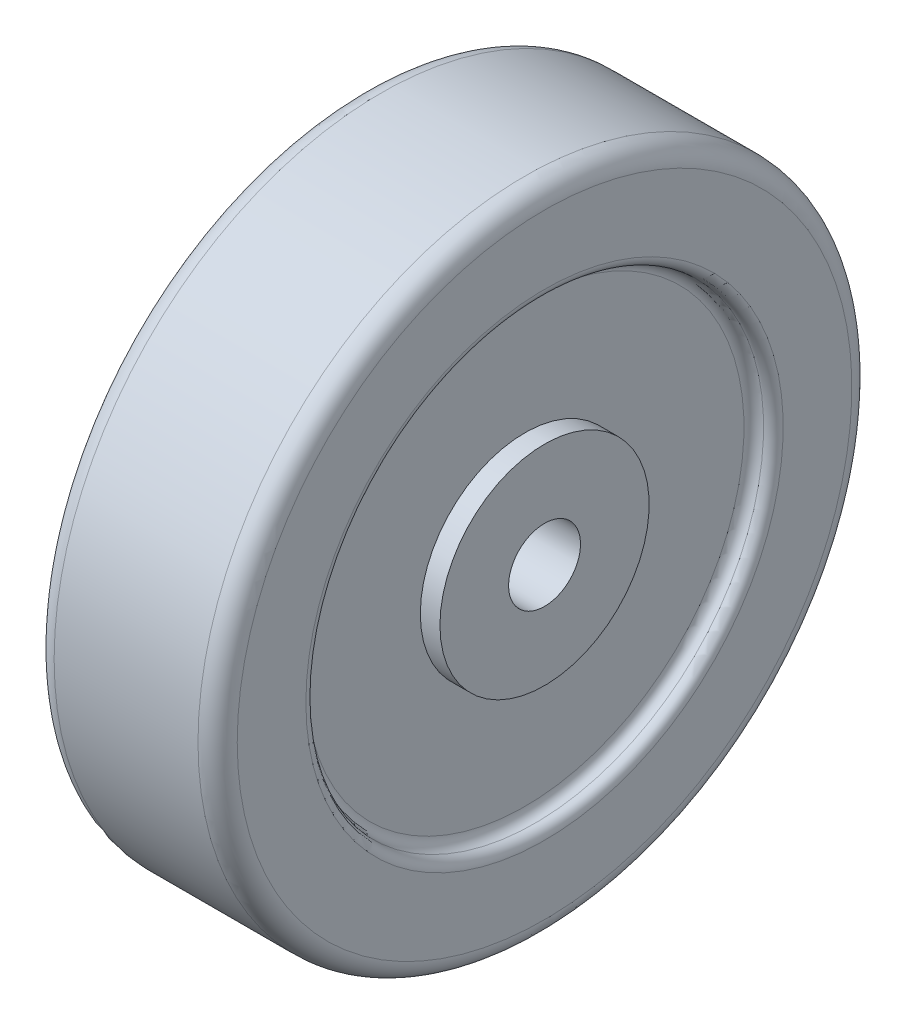
from build123d import *

# Parameters (mm, degrees)
FILLET1_R = 3
FILLET2_R = 1.5


with BuildPart() as part:
    # Sketch1 → Revolve1 (revolve)
    with BuildSketch(Plane.XY, mode=Mode.PRIVATE) as revolve1_sk:
        Polygon((0, 50), (28, 50), (28, 35), (25, 35), (25, 16), (28, 16), (28, 5.5), (0, 5.5), (0, 16), (3, 16), (3, 35), (0, 35), align=None)
    revolve(revolve1_sk.sketch.rotate(Axis((0, 0, 0), (1, 0, 0)), 90), axis=Axis((0, 0, 0), (1, 0, 0)))

    # Fillet1
    fillet1_edges = [part.edges().sort_by_distance(p)[0] for p in [
        (28, 0, -50),
        (0, 0, -50),
    ]]
    fillet(fillet1_edges, radius=FILLET1_R)

    # Fillet2
    fillet2_edges = [part.edges().sort_by_distance(p)[0] for p in [
        (25, 0, -35),
        (28, 0, -35),
        (0, 0, -35),
        (3, 0, -35),
    ]]
    fillet(fillet2_edges, radius=FILLET2_R - 0.0001)  # a hair under: the kernel refuses the full size


solid = part.part
